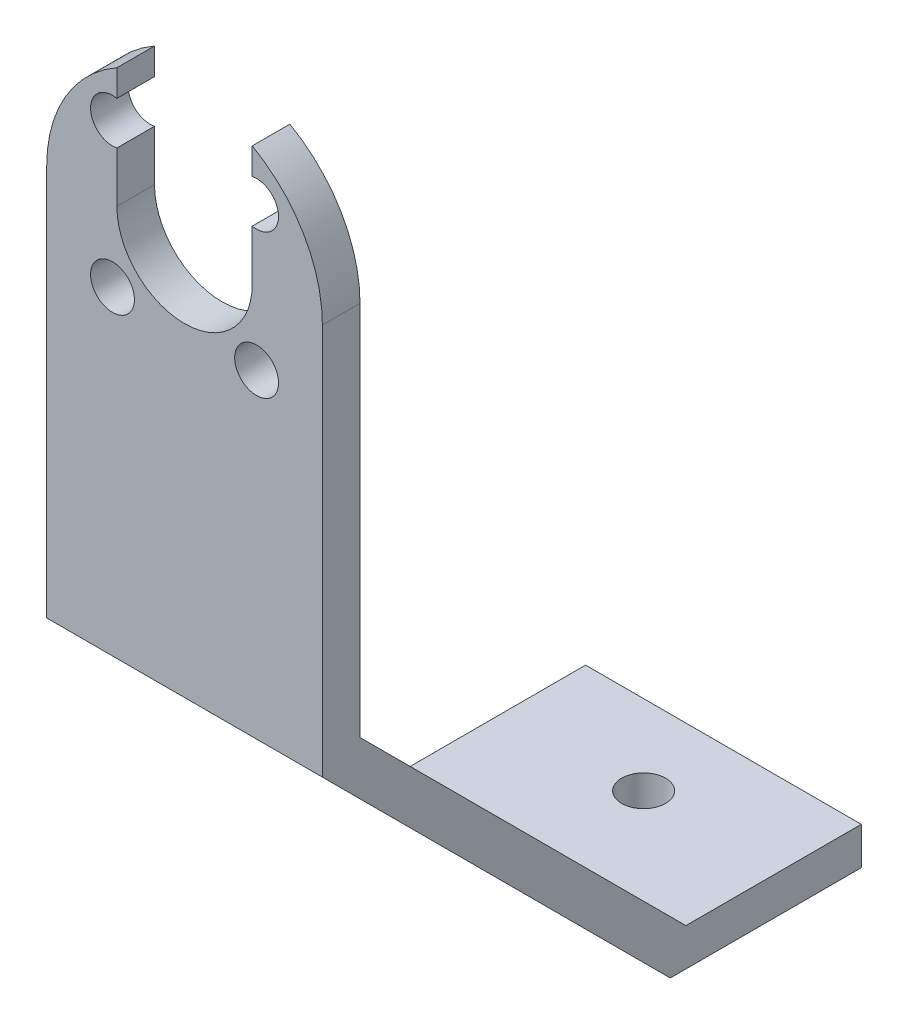
from build123d import *

# Parameters (mm, degrees)
SKETCH1_R           = 1.75
BOSS_EXTRUDE1_DEPTH = 3
BOSS_EXTRUDE2_DEPTH = 3
SKETCH4_W           = 40
SKETCH4_H           = 3
BOSS_EXTRUDE3_DEPTH = 22
SKETCH5_R           = 1.75
CUT_EXTRUDE1_DEPTH  = 10
BOSS_EXTRUDE4_DEPTH = 1
BOSS_EXTRUDE5_DEPTH = 22
CUT_EXTRUDE2_DEPTH  = 75.598927606


# Read off the part's stored shape, not the designer's step: Boss-Extrude2
with BuildPart() as part:
    # Sketch1 → Boss-Extrude1 (new body)
    with BuildSketch(Plane.XY):
        with BuildLine():
            Line((5.4, 4.03535718), (5.4, 0))
            ThreePointArc((5.4, 0), (0, -5.4), (-5.4, 0))
            Line((-5.4, 0), (-5.4, 4.03535718))
            ThreePointArc((-5.4, 4.03535718), (-7.5, 5.75), (-5.4, 7.46464282))
            Line((-5.4, 7.46464282), (-5.4, 9.583318841))
            ThreePointArc((-5.4, 9.583318841), (0, -11), (5.4, 9.583318841))
            Line((5.4, 9.583318841), (5.4, 7.46464282))
            ThreePointArc((5.4, 7.46464282), (6.856797181, 7.105544171), (7.5, 5.75))
            ThreePointArc((7.5, 5.75), (6.856797181, 4.394455829), (5.4, 4.03535718))
        make_face()
        with Locations((-5.75, -5.75)):
            Circle(SKETCH1_R, mode=Mode.SUBTRACT)
        with Locations((5.75, -5.75)):
            Circle(SKETCH1_R, mode=Mode.SUBTRACT)
    extrude(amount=BOSS_EXTRUDE1_DEPTH)

    # Boss-Extrude2 outline → Boss-Extrude2 (add)
    with BuildSketch(Plane.XY):
        with BuildLine():
            Line((-11, 0), (-11, -59))
            Line((-11, -59), (11, -59))
            Line((11, -59), (11, 0))
            ThreePointArc((11, 0), (0, -11), (-11, 0))
        make_face()
    extrude(amount=BOSS_EXTRUDE2_DEPTH)

    # Sketch4 → Boss-Extrude3 (add)
    with BuildSketch(Plane.ZY.offset(11)):
        with Locations((-20, -57.5)):
            Rectangle(SKETCH4_W, SKETCH4_H)
    extrude(amount=-BOSS_EXTRUDE3_DEPTH)

    # Sketch5 → Cut-Extrude1 (cut)
    with BuildSketch(Plane(origin=(0, -59, 0), x_dir=(-1, 0, 0), z_dir=(0, -1, 0))):
        with Locations(Location((0, 33.63, 0), (0, 0, 90))):
            Circle(SKETCH5_R)
    extrude(amount=-CUT_EXTRUDE1_DEPTH, mode=Mode.SUBTRACT)

    # Sketch6 → Boss-Extrude4 (add)
    with BuildSketch(Plane.ZY.offset(11)):
        Polygon((-20, -56), (0, -36), (0, -56), align=None)
    boss_extrude4 = extrude(amount=-BOSS_EXTRUDE4_DEPTH)

    # Mirror1: Boss-Extrude4 across plane
    add(boss_extrude4.mirror(Plane(origin=(0, 0, 0), x_dir=(0, 0, 1), z_dir=(1, 0, 0))))

    # Sketch7 → Boss-Extrude5 (add, through all)
    with BuildSketch(Plane(origin=(11, 0, 0), x_dir=(0, 0, -1), z_dir=(1, 0, 0))):
        Polygon((0, -30), (26, -56), (21.757359313, -56), (0, -34.242640687), align=None)
    extrude(amount=-BOSS_EXTRUDE5_DEPTH)

    # Sketch8 → Cut-Extrude2 (cut, through all)
    with BuildSketch(Plane(origin=(11, 0, 0), x_dir=(0, 0, -1), z_dir=(1, 0, 0))):
        Polygon((10.878679656, -45.121320344), (24.757359313, -59), (-3, -59), (-3, -31.242640687), align=None)
    extrude(amount=-CUT_EXTRUDE2_DEPTH, mode=Mode.SUBTRACT)


solid = part.part
